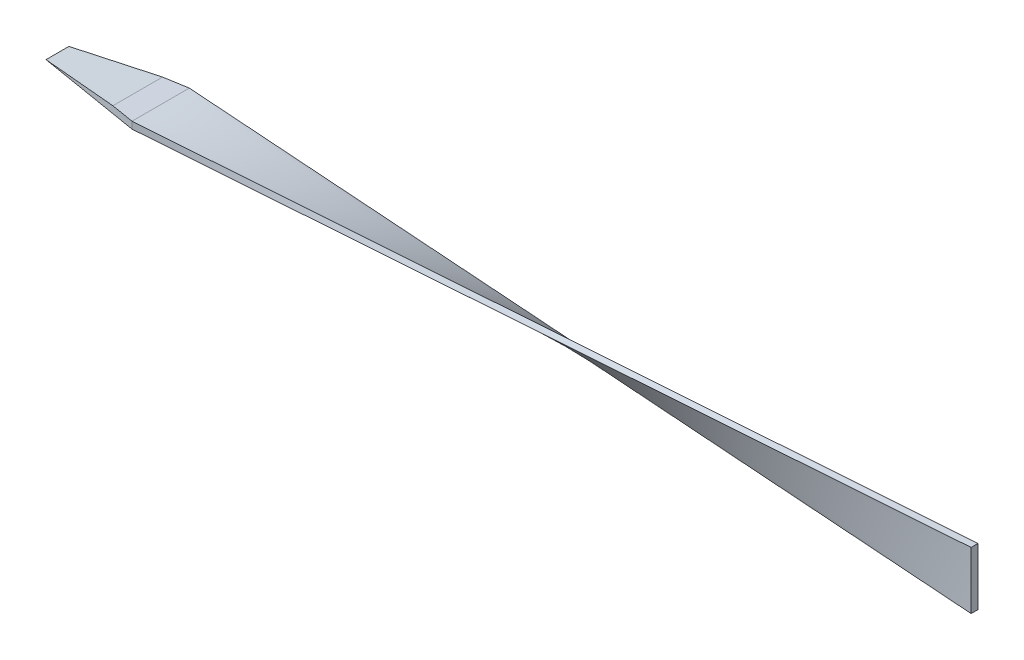
from build123d import *

# Parameters (mm, degrees)
BOSS_EXTRUDE1_DEPTH = 0.06
CUT_EXTRUDE3_DEPTH  = 9.09728967
CUT_EXTRUDE4_DEPTH  = 9.09728967
CUT_EXTRUDE5_DEPTH  = 2.5
SKETCH7_W           = 7.1
SKETCH7_H           = 0.5
CUT_EXTRUDE6_DEPTH  = 2.5


with BuildPart() as part:
    # Sketch1 → Boss-Extrude1 (new body)
    with BuildSketch(Plane(origin=(0, 0, 0), x_dir=(1, 0, 0), z_dir=(0, 1, 0))):
        with BuildLine():
            ThreePointArc((-0.362264151, -0.932075472), (-0.747576714, -0.664175471), (-0.968245837, -0.25))
            Line((-0.968245837, -0.25), (-4, -0.25))
            Line((-4, -0.25), (-0.362264151, -0.932075472))
        make_face()
        with BuildLine():
            ThreePointArc((-0.968245837, 0.25), (-0.747576714, 0.664175471), (-0.362264151, 0.932075472))
            Line((-0.362264151, 0.932075472), (-4, 0.25))
            Line((-4, 0.25), (-0.968245837, 0.25))
        make_face()
        with BuildLine():
            ThreePointArc((-0.968245837, -0.25), (-1, 0), (-0.968245837, 0.25))
            Line((-0.968245837, 0.25), (-4, 0.25))
            Line((-4, 0.25), (-8, 0.25))
            Line((-8, 0.25), (-8, -0.25))
            Line((-8, -0.25), (-4, -0.25))
            Line((-4, -0.25), (-0.968245837, -0.25))
        make_face()
        with BuildLine():
            Line((0, -1), (0, -0.25))
            Line((0, -0.25), (-0.968245837, -0.25))
            ThreePointArc((-0.968245837, -0.25), (-0.747576714, -0.664175471), (-0.362264151, -0.932075472))
            Line((-0.362264151, -0.932075472), (0, -1))
        make_face()
        with BuildLine():
            Line((0, 0.25), (0, 1))
            Line((0, 1), (-0.362264151, 0.932075472))
            ThreePointArc((-0.362264151, 0.932075472), (-0.747576714, 0.664175471), (-0.968245837, 0.25))
            Line((-0.968245837, 0.25), (0, 0.25))
        make_face()
        with BuildLine():
            Line((0, -0.25), (0, 0.25))
            Line((0, 0.25), (-0.968245837, 0.25))
            ThreePointArc((-0.968245837, 0.25), (-1, 0), (-0.968245837, -0.25))
            Line((-0.968245837, -0.25), (0, -0.25))
        make_face()
    extrude(amount=BOSS_EXTRUDE1_DEPTH)

    # Sketch5 → Cut-Extrude3 (cut, through all)
    with BuildSketch(Plane.XY.offset(0.25)):
        Polygon((-8, 0), (-8, 0.06), (-7.3, 0.06), align=None)
    extrude(amount=-CUT_EXTRUDE3_DEPTH, mode=Mode.SUBTRACT)

    # 3DSketch1 → Cut-Extrude4 (cut, through all)
    with BuildSketch(Plane(origin=(-8, 0.06, 0.25), x_dir=(0.8741572761215382, 0, -0.48564293117863155), z_dir=(0, 1, 0))):
        Polygon((0, 0), (0.07284644, 0.131123591), (0.786741549, -0.437078638), align=None)
        Polygon((1.029563014, 0), (0.242821466, 0.437078638), (0.169975026, 0.305955047), align=None)
    extrude(amount=-CUT_EXTRUDE4_DEPTH, mode=Mode.SUBTRACT)

    # Sketch6 → Cut-Extrude5 (cut)
    with BuildSketch(Plane(origin=(0, 0.06, 0), x_dir=(1, 0, 0), z_dir=(0, 1, 0))):
        Polygon((0, 1), (-4, 0.25), (0, 0.25), align=None)
        Polygon((0, -0.25), (-4, -0.25), (0, -1), align=None)
    extrude(amount=-CUT_EXTRUDE5_DEPTH, mode=Mode.SUBTRACT)

    # Sketch7 → Cut-Extrude6 (cut)
    with BuildSketch(Plane(origin=(0, 0.06, 0), x_dir=(1, 0, 0), z_dir=(0, 1, 0))):
        with Locations((-3.55, 0)):
            Rectangle(SKETCH7_W, SKETCH7_H)
    extrude(amount=-CUT_EXTRUDE6_DEPTH, mode=Mode.SUBTRACT)

    # Loft3: read off the stored shape, not the designer's step
    # Loft3: loft between two sections, ruled curve by curve
    loft3_from = [
        Edge.make_bspline([(0, 0.28, -0.03), (0, 0.196666667, -0.03), (0, 0.113333333, -0.03), (0, -0.053333333, -0.03), (0, -0.136666667, -0.03), (0, -0.22, -0.03)], [0, 0, 0, 0, 0.5, 0.5, 1, 1, 1, 1], 3),
        Edge.make_bspline([(0, -0.22, -0.03), (0, -0.22, -0.02), (0, -0.22, -0.01), (0, -0.22, 0.01), (0, -0.22, 0.02), (0, -0.22, 0.03)], [0, 0, 0, 0, 0.5, 0.5, 1, 1, 1, 1], 3),
        Edge.make_bspline([(0, 0.28, 0.03), (0, 0.28, 0.02), (0, 0.28, 0.01), (0, 0.28, -0.01), (0, 0.28, -0.02), (0, 0.28, -0.03)], [0, 0, 0, 0, 0.5, 0.5, 1, 1, 1, 1], 3),
        Edge.make_bspline([(0, -0.22, 0.03), (0, -0.136666667, 0.03), (0, -0.053333333, 0.03), (0, 0.113333333, 0.03), (0, 0.196666667, 0.03), (0, 0.28, 0.03)], [0, 0, 0, 0, 0.5, 0.5, 1, 1, 1, 1], 3),
    ]
    loft3_to = [
        Edge.make_bspline([(-7.1, 0.06, 0.25), (-7.1, 0.06, 0.166666667), (-7.1, 0.06, 0.083333333), (-7.1, 0.06, -0.083333333), (-7.1, 0.06, -0.166666667), (-7.1, 0.06, -0.25)], [0, 0, 0, 0, 0.5, 0.5, 1, 1, 1, 1], 3),
        Edge.make_bspline([(-7.1, 0.06, -0.25), (-7.1, 0.05, -0.25), (-7.1, 0.04, -0.25), (-7.1, 0.02, -0.25), (-7.1, 0.01, -0.25), (-7.1, 0, -0.25)], [0, 0, 0, 0, 0.5, 0.5, 1, 1, 1, 1], 3),
        Edge.make_bspline([(-7.1, 0, 0.25), (-7.1, 0.01, 0.25), (-7.1, 0.02, 0.25), (-7.1, 0.04, 0.25), (-7.1, 0.05, 0.25), (-7.1, 0.06, 0.25)], [0, 0, 0, 0, 0.5, 0.5, 1, 1, 1, 1], 3),
        Edge.make_bspline([(-7.1, 0, -0.25), (-7.1, 0, -0.166666667), (-7.1, 0, -0.083333333), (-7.1, 0, 0.083333333), (-7.1, 0, 0.166666667), (-7.1, 0, 0.25)], [0, 0, 0, 0, 0.5, 0.5, 1, 1, 1, 1], 3),
    ]
    loft3 = Solid(Shell([*[Face.make_surface_from_curves(loft3_from[k], loft3_to[k]) for k in range(4)], Face(Wire(loft3_from)), Face(Wire(loft3_to))]))
    add(loft3)


solid = part.part
